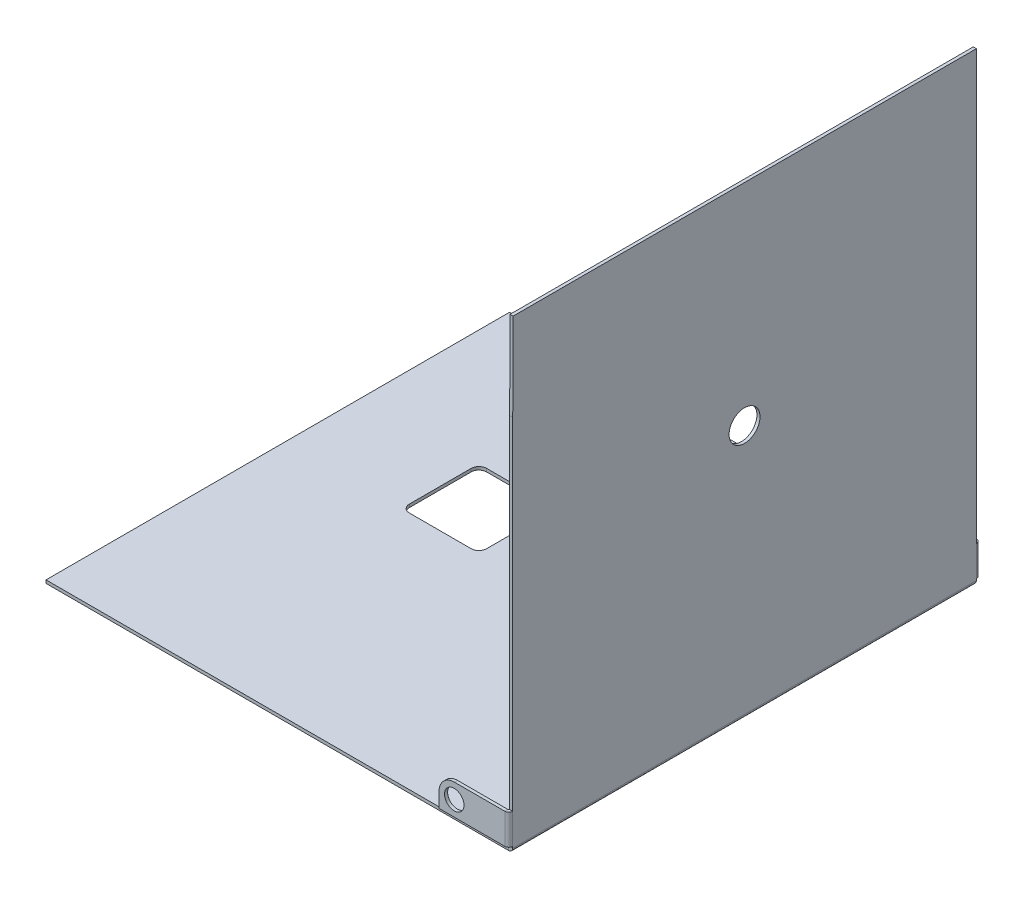
from build123d import *
from build123d.topology import SkipClean

# Parameters (mm, degrees)
BASE_FLANGE1_DEPTH       = 2.54
SKETCHED_START           = 383.54
SKETCHED_BEND2_OUTLINE_W = 2.54
SKETCHED_BEND2_OUTLINE_H = 495.3
SKETCHED_BEND2_DEPTH     = 378.46
SKETCHED_START_2         = 381
SKETCHED_BEND2_2_DEPTH   = 2.221317884
SKETCHED_START_3         = 380.2634
SKETCHED_BEND2_3_DEPTH   = 3.2766
SKETCHED_START_4         = -438.15
SKETCHED_BEND2_4_DEPTH   = 495.3
SKETCHED_START_5         = 2.131240091
SKETCHED_BEND7_DEPTH     = 25
SKETCHED_BEND7_2_DEPTH   = 12.3
SKETCHED_START_6         = -384.2766
SKETCHED_BEND7_3_DEPTH   = 3.158240169
SKETCHED_START_7         = 0.118359831
SKETCHED_BEND7_4_DEPTH   = 3.158240169
SKETCHED_START_8         = 14.431240091
SKETCHED_BEND7_5_DEPTH   = 12.7
SKETCHED_BEND7_6_DEPTH   = 12.7
SKETCH20_R               = 8
CUT_EXTRUDE1_DEPTH       = 665.217598099
SKETCH21_R               = 12.7
CUT_EXTRUDE2_DEPTH       = 2.54
CUT_EXTRUDE3_DEPTH       = 2.54


with BuildPart() as part:
    # Base-Flange1: sheet metal written as solids
    # Sketch1 → Base-Flange1 (new body)
    with BuildSketch(Plane(origin=(0, 0, 0), x_dir=(1, 0, 0), z_dir=(0, 1, 0))):
        with BuildLine():
            Line((0, 0), (0, 381))
            Line((0, 381), (384.81, 381))
            Line((384.81, 381), (384.81, 438.15))
            Line((384.81, 438.15), (397.11, 438.15))
            ThreePointArc((397.11, 438.15), (406.090256121, 434.430256121), (409.81, 425.45))
            Line((409.81, 425.45), (409.81, 381))
            Line((409.81, 381), (690.157951031, 381))
            Line((690.157951031, 381), (762, 381))
            Line((762, 381), (762, 0.361010763))
            Line((762, 0.361010763), (690.158858088, 0))
            Line((690.158858088, 0), (409.81, 0))
            Line((409.81, 0), (409.81, -44.45))
            ThreePointArc((409.81, -44.45), (406.090256121, -53.430256121), (397.11, -57.15))
            Line((397.11, -57.15), (384.81, -57.15))
            Line((384.81, -57.15), (384.81, 0))
            Line((384.81, 0), (0, 0))
        make_face()
    extrude(amount=-BASE_FLANGE1_DEPTH)

    # Sketched Bend2: read off the stored shape, not the designer's step
    # Sketched Bend2 outline → Sketched Bend2 (cut)
    with BuildSketch(Plane.YZ.offset(SKETCHED_START)):
        with Locations((-1.27, -190.5)):
            Rectangle(SKETCHED_BEND2_OUTLINE_W, SKETCHED_BEND2_OUTLINE_H)
    extrude(amount=SKETCHED_BEND2_DEPTH, mode=Mode.SUBTRACT)

    # Sketched Bend2 2 outline → Sketched Bend2 2 (add)
    with BuildSketch(Plane.YZ.offset(SKETCHED_START_2)):
        with BuildLine():
            Line((2.131240091, 57.15), (2.131240091, 0))
            Line((2.131240091, 0), (0, 0))
            Line((0, 0), (0, -381))
            Line((0, -381), (2.131240091, -381))
            Line((2.131240091, -381), (2.131240091, -438.15))
            Line((2.131240091, -438.15), (14.431240091, -438.15))
            ThreePointArc((14.431240091, -438.15), (23.411496212, -434.430256121), (27.131240091, -425.45))
            Line((27.131240091, -425.45), (27.131240091, -381))
            Line((27.131240091, -381), (379.321240091, -381))
            Line((379.321240091, -381), (379.321240091, -0.361010763))
            Line((379.321240091, -0.361010763), (307.480098179, 0))
            Line((307.480098179, 0), (27.131240091, 0))
            Line((27.131240091, 0), (27.131240091, 44.45))
            ThreePointArc((27.131240091, 44.45), (23.411496212, 53.430256121), (14.431240091, 57.15))
            Line((14.431240091, 57.15), (2.131240091, 57.15))
        make_face()
    extrude(amount=SKETCHED_BEND2_2_DEPTH)

    # Sketched Bend2 3 outline → Sketched Bend2 3 (add)
    with BuildSketch(Plane.YZ.offset(SKETCHED_START_3)):
        with BuildLine():
            Line((2.131240091, 57.15), (2.131240091, 0))
            Line((2.131240091, 0), (0, 0))
            Line((0, 0), (0, -381))
            Line((0, -381), (2.131240091, -381))
            Line((2.131240091, -381), (2.131240091, -438.15))
            Line((2.131240091, -438.15), (14.431240091, -438.15))
            ThreePointArc((14.431240091, -438.15), (23.411496212, -434.430256121), (27.131240091, -425.45))
            Line((27.131240091, -425.45), (27.131240091, -381))
            Line((27.131240091, -381), (379.321240091, -381))
            Line((379.321240091, -381), (379.321240091, -0.361010763))
            Line((379.321240091, -0.361010763), (307.480098179, 0))
            Line((307.480098179, 0), (27.131240091, 0))
            Line((27.131240091, 0), (27.131240091, 44.45))
            ThreePointArc((27.131240091, 44.45), (23.411496212, 53.430256121), (14.431240091, 57.15))
            Line((14.431240091, 57.15), (2.131240091, 57.15))
        make_face()
    extrude(amount=SKETCHED_BEND2_3_DEPTH)

    # Sketched Bend2 4 outline → Sketched Bend2 4 (cut)
    with BuildSketch(Plane.XY.offset(SKETCHED_START_4)):
        with BuildLine():
            ThreePointArc((380.2634, 0), (380.784254855, 0.215745145), (381, 0.7366))
            Line((381, 0.7366), (381, 379.321240091))
            Line((381, 379.321240091), (380.2634, 379.321240091))
            Line((380.2634, 379.321240091), (380.2634, 0))
        make_face()
        with BuildLine():
            Line((383.54, -2.54), (383.54, 0.7366))
            ThreePointArc((383.54, 0.7366), (382.580306079, -1.580306079), (380.2634, -2.54))
            Line((380.2634, -2.54), (383.54, -2.54))
        make_face()
    extrude(amount=SKETCHED_BEND2_4_DEPTH, mode=Mode.SUBTRACT)

    # Sketched Bend7: read off the stored shape, not the designer's step
    # Sketched Bend7 outline → Sketched Bend7 (cut)
    with BuildSketch(Plane(origin=(0, 0, 0), x_dir=(1, 0, 0), z_dir=(0, 1, 0)).offset(SKETCHED_START_5)):
        with BuildLine():
            Line((383.54, -57.15), (383.54, 0))
            ThreePointArc((383.54, 0), (382.827542266, -2.039922057), (381, -3.192730493))
            Line((381, -3.192730493), (381, -57.15))
            Line((381, -57.15), (383.54, -57.15))
        make_face()
        with BuildLine():
            ThreePointArc((381, 384.192730493), (382.827542266, 383.039922057), (383.54, 381))
            Line((383.54, 381), (383.54, 438.15))
            Line((383.54, 438.15), (381, 438.15))
            Line((381, 438.15), (381, 384.192730493))
        make_face()
    extrude(amount=SKETCHED_BEND7_DEPTH, mode=Mode.SUBTRACT)

    # Sketched Bend7 2 outline → Sketched Bend7 2 (add)
    with BuildSketch(Plane(origin=(0, 0, 0), x_dir=(1, 0, 0), z_dir=(0, 1, 0)).offset(SKETCHED_START_5)):
        with BuildLine():
            ThreePointArc((380.2634, -3.2766), (380.634079664, -3.255565104), (381, -3.192730493))
            Line((381, -3.192730493), (381, 0))
            ThreePointArc((381, 0), (380.784254855, -0.520854855), (380.2634, -0.7366))
            Line((380.2634, -0.7366), (326.265359909, -0.7366))
            Line((326.265359909, -0.7366), (326.265359909, -3.2766))
            Line((326.265359909, -3.2766), (380.2634, -3.2766))
        make_face()
        with BuildLine():
            Line((381, 381), (381, 384.192730493))
            ThreePointArc((381, 384.192730493), (380.634079664, 384.255565104), (380.2634, 384.2766))
            Line((380.2634, 384.2766), (326.265359909, 384.2766))
            Line((326.265359909, 384.2766), (326.265359909, 381.7366))
            Line((326.265359909, 381.7366), (380.2634, 381.7366))
            ThreePointArc((380.2634, 381.7366), (380.784254855, 381.520854855), (381, 381))
        make_face()
    extrude(amount=SKETCHED_BEND7_2_DEPTH)

    # Sketched Bend7 3 outline → Sketched Bend7 3 (add)
    with BuildSketch(Plane.XY.offset(SKETCHED_START_6)):
        with BuildLine():
            Line((381, 14.431240091), (381, 27.131240091))
            Line((381, 27.131240091), (338.965359909, 27.131240091))
            ThreePointArc((338.965359909, 27.131240091), (329.985103788, 23.411496212), (326.265359909, 14.431240091))
            Line((326.265359909, 14.431240091), (381, 14.431240091))
        make_face()
    extrude(amount=SKETCHED_BEND7_3_DEPTH)

    # Sketched Bend7 4 outline → Sketched Bend7 4 (add)
    with BuildSketch(Plane.XY.offset(SKETCHED_START_7)):
        with BuildLine():
            Line((381, 14.431240091), (381, 27.131240091))
            Line((381, 27.131240091), (338.965359909, 27.131240091))
            ThreePointArc((338.965359909, 27.131240091), (329.985103788, 23.411496212), (326.265359909, 14.431240091))
            Line((326.265359909, 14.431240091), (381, 14.431240091))
        make_face()
    extrude(amount=SKETCHED_BEND7_4_DEPTH)

    # Sketched Bend7 5 outline → Sketched Bend7 5 (cut)
    with SkipClean():  # the faces are left unmerged after this step: merging them gives an invalid solid
        with BuildSketch(Plane(origin=(0, 0, 0), x_dir=(1, 0, 0), z_dir=(0, 1, 0)).offset(SKETCHED_START_8)):
            with BuildLine():
                Line((381, -3.2766), (381, -3.192730493))
                ThreePointArc((381, -3.192730493), (380.634079664, -3.255565104), (380.2634, -3.2766))
                Line((380.2634, -3.2766), (325, -3.276600014))
                Line((325, -3.276600014), (325, -5))
                Line((325, -5), (381.000000013, -5))
                Line((381.000000013, -5), (381, -3.2766))
            make_face()
            with BuildLine():
                ThreePointArc((380.2634, -0.7366), (380.740576963, -0.561143213), (380.990428549, -0.118359831))
                Line((380.990428549, -0.118359831), (325, -0.118359831))
                Line((325, -0.118359831), (325, -0.7366))
                Line((325, -0.7366), (380.2634, -0.7366))
            make_face()
            with BuildLine():
                Line((325, 381.118359831), (380.990428549, 381.118359831))
                ThreePointArc((380.990428549, 381.118359831), (380.740576963, 381.561143213), (380.2634, 381.7366))
                Line((380.2634, 381.7366), (325, 381.7366))
                Line((325, 381.7366), (325, 381.118359831))
            make_face()
            with BuildLine():
                ThreePointArc((380.2634, 384.2766), (380.634079664, 384.255565104), (381, 384.192730493))
                Line((381, 384.192730493), (381, 384.2766))
                Line((381, 384.2766), (381.000000039, 386))
                Line((381.000000039, 386), (325, 386))
                Line((325, 386), (325, 384.276600014))
                Line((325, 384.276600014), (380.2634, 384.2766))
            make_face()
        extrude(amount=SKETCHED_BEND7_5_DEPTH, mode=Mode.SUBTRACT)

    # Sketched Bend7 6 outline → Sketched Bend7 6 (add)
    with SkipClean():  # the faces are left unmerged after this step: merging them gives an invalid solid
        with BuildSketch(Plane(origin=(0, 0, 0), x_dir=(1, 0, 0), z_dir=(0, 1, 0)).offset(SKETCHED_START_8)):
            with BuildLine():
                Line((380.990428549, -0.118359831), (381, -0.118359831))
                Line((381, -0.118359831), (381, 0))
                ThreePointArc((381, 0), (380.997603238, -0.059373105), (380.990428549, -0.118359831))
            make_face()
            with BuildLine():
                ThreePointArc((380.990428549, 381.118359831), (380.997603238, 381.059373105), (381, 381))
                Line((381, 381), (381.000000039, 381.118359831))
                Line((381.000000039, 381.118359831), (380.990428549, 381.118359831))
            make_face()
        extrude(amount=SKETCHED_BEND7_6_DEPTH)

    # Sketch20 → Cut-Extrude1 (cut, through all)
    with SkipClean():  # the faces are left unmerged after this step: merging them gives an invalid solid
        with BuildSketch(Plane.XY.offset(3.2766)):
            with Locations((338.765359909, 14.631240091)):
                Circle(SKETCH20_R)
        extrude(amount=-CUT_EXTRUDE1_DEPTH, mode=Mode.SUBTRACT)

    # Sketch21 → Cut-Extrude2 (cut)
    with SkipClean():  # the faces are left unmerged after this step: merging them gives an invalid solid
        with BuildSketch(Plane(origin=(383.54, 0, 0), x_dir=(0, 0, -1), z_dir=(1, 0, 0))):
            with Locations(Location((190.5, 206.347240091, 0), (0, 0, 90))):
                Circle(SKETCH21_R)
        extrude(amount=-CUT_EXTRUDE2_DEPTH, mode=Mode.SUBTRACT)

    # Sketch22 → Cut-Extrude3 (cut)
    with SkipClean():  # the faces are left unmerged after this step: merging them gives an invalid solid
        with BuildSketch(Plane.XZ.offset(2.54)):
            with BuildLine():
                Line((101.704654894, -196.888541513), (152.504654894, -196.888541513))
                ThreePointArc((152.504654894, -196.888541513), (156.994782955, -198.748413452), (158.854654894, -203.238541513))
                Line((158.854654894, -203.238541513), (158.854654894, -254.038541513))
                ThreePointArc((158.854654894, -254.038541513), (156.994782955, -258.528669573), (152.504654894, -260.388541513))
                Line((152.504654894, -260.388541513), (101.704654894, -260.388541513))
                ThreePointArc((101.704654894, -260.388541513), (97.214526834, -258.528669573), (95.354654894, -254.038541513))
                Line((95.354654894, -254.038541513), (95.354654894, -203.238541513))
                ThreePointArc((95.354654894, -203.238541513), (97.214526834, -198.748413452), (101.704654894, -196.888541513))
            make_face()
        extrude(amount=-CUT_EXTRUDE3_DEPTH, mode=Mode.SUBTRACT)


solid = part.part
